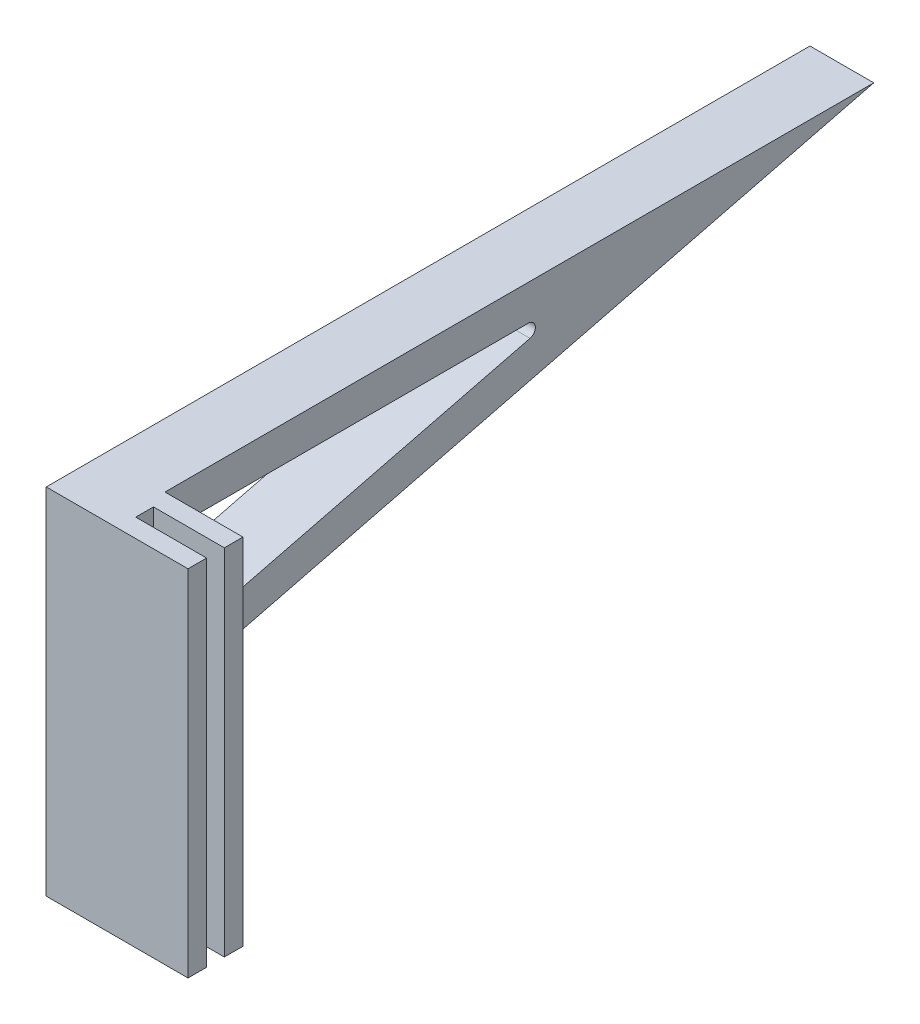
from build123d import *

# Parameters (mm, degrees)
BOSS_EXTRUDE1_DEPTH = 100
EXTRUDE_THIN3_START = -18
EXTRUDE_THIN3_DEPTH = 18
FILLET5_R           = 3
FILLET6_R           = 2
FILLET7_R           = 3
FILLET8_R           = 2
CUT_EXTRUDE1_REACH  = 226.499
SKETCH4_R           = 2.5


# Read off the part's stored shape, not the designer's step: Extrude-Thin3
with BuildPart() as part:
    # Sketch1 → Boss-Extrude1 (new body)
    with BuildSketch(Plane(origin=(0, 0, 0), x_dir=(1, 0, 0), z_dir=(0, 1, 0))):
        Polygon((0, 0), (20, 0), (20, -5.25), (-20, -5.25), (-20, 10.25), (20, 10.25), (20, 5), (0, 5), align=None)
    extrude(amount=BOSS_EXTRUDE1_DEPTH)

    # Extrude-Thin3 outline → Extrude-Thin3 (add)
    with BuildSketch(Plane.ZY.offset(20).offset(EXTRUDE_THIN3_START)):
        Polygon((-10.25, 100), (-210.25, 100), (-10.25, 50), (-10.25, 60.307764064), (-129.018943744, 90), (-10.25, 90), align=None)
    extrude(amount=EXTRUDE_THIN3_DEPTH)

    # Fillet5
    fillet5_edges = [part.edges().sort_by_distance(p)[0] for p in [
        (-11, 50, -10.25),
    ]]
    fillet(fillet5_edges, radius=FILLET5_R)

    # Fillet6
    fillet6_edges = [part.edges().sort_by_distance(p)[0] for p in [
        (-11, 60.307764064, -10.25),
    ]]
    fillet(fillet6_edges, radius=FILLET6_R)

    # Fillet7
    fillet7_edges = [part.edges().sort_by_distance(p)[0] for p in [
        (-11, 90, -10.25),
    ]]
    fillet(fillet7_edges, radius=FILLET7_R)

    # Fillet8
    fillet8_edges = [part.edges().sort_by_distance(p)[0] for p in [
        (-11, 90, -129.018943744),
    ]]
    fillet(fillet8_edges, radius=FILLET8_R)

    # Sketch4 → Cut-Extrude1 (cut, up to next)
    with BuildSketch(Plane(origin=(0, 0, -10.25), x_dir=(-1, 0, 0), z_dir=(0, 0, -1)), mode=Mode.PRIVATE) as cut_extrude1_sk1:
        with Locations((-10, 50)):
            Circle(SKETCH4_R)
    cut_extrude1_tool1 = extrude(cut_extrude1_sk1.sketch, amount=-CUT_EXTRUDE1_REACH, mode=Mode.PRIVATE) & part.part
    add(cut_extrude1_tool1.solids().sort_by_distance((10, 50, -10.25))[0], mode=Mode.SUBTRACT)


solid = part.part
